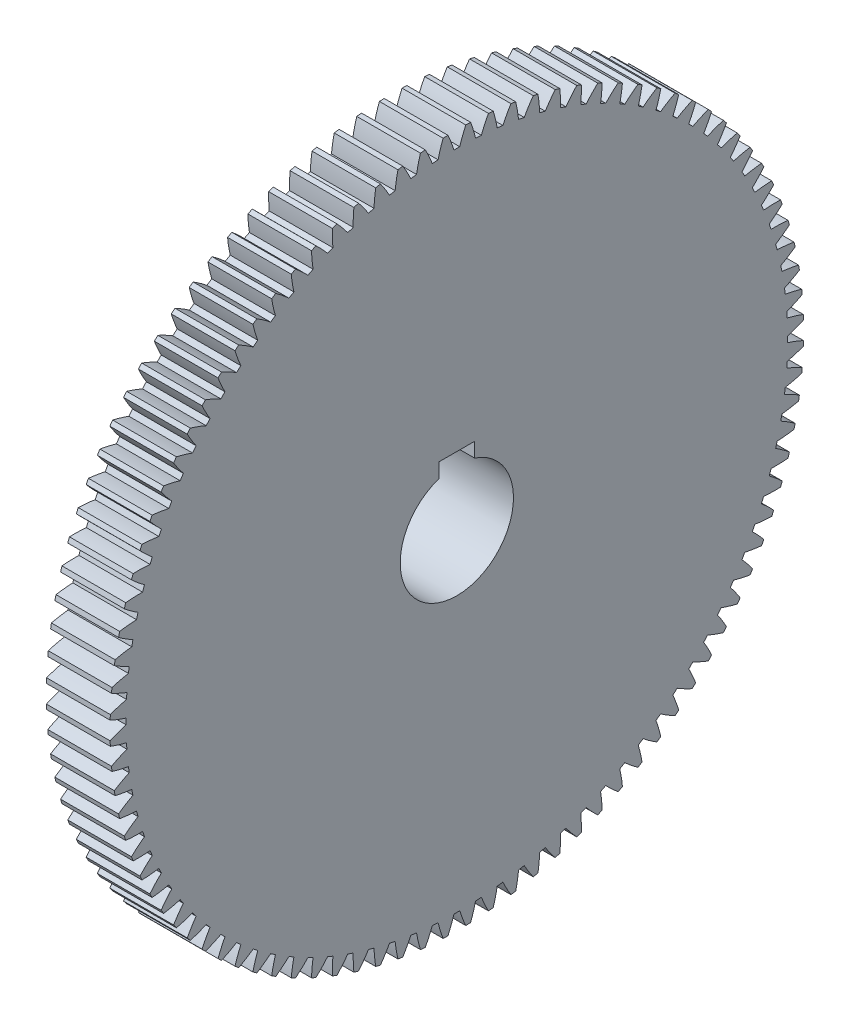
from build123d import *

# Parameters (mm, degrees)
BASPROSKE_W      = 18
BASPROSKE_H      = 98
TOOTHCUT_DEPTH   = 140.75693185
TEETHCUTS_COUNT  = 96
HUBNEAONESKE_R   = 30
HUBNEARONE_DEPTH = 13.5
BORSKE_R         = 16
BORE_DEPTH       = 30.0000508
KEYSKE_W         = 10
KEYSKE_H         = 19.3
KEYWAY_DEPTH     = 30.0000508


with BuildPart() as part:
    # BasProSke → Base-Revolve (revolve)
    with BuildSketch(Plane(origin=(0, 0, 0), x_dir=(1, 0, 0), z_dir=(0, 1, 0))):
        with Locations((9, 49)):
            Rectangle(BASPROSKE_W, BASPROSKE_H)
    revolve(axis=Axis((-10, 0, 0), (1, 0, 0)))

    # TooCutSke → ToothCut (cut, through all)
    with BuildSketch(Plane(origin=(0, 0, 0), x_dir=(0, 0, -1), z_dir=(1, 0, 0))):
        with BuildLine():
            ThreePointArc((0.816302804, 93.495436524), (0, 93.499), (-0.816302804, 93.495436524))
            ThreePointArc((-0.816302804, 93.495436524), (-1.605364709, 95.770990559), (-2.535528881, 97.992602468))
            ThreePointArc((-2.535528881, 97.992602468), (0, 98.0254), (2.535528881, 97.992602468))
            ThreePointArc((2.535528881, 97.992602468), (1.605364709, 95.770990559), (0.816302804, 93.495436524))
        make_face()
    toothcut = extrude(amount=TOOTHCUT_DEPTH, mode=Mode.SUBTRACT)

    # TeethCuts: ToothCut ×96 about axis
    teethcuts_axis = Axis((-10, 0, 0), (1, 0, 0))
    for i in range(1, TEETHCUTS_COUNT):
        add(toothcut.rotate(teethcuts_axis, i * 360 / TEETHCUTS_COUNT), mode=Mode.SUBTRACT)

    # HubNeaOneSke → HubNearOne (add)
    with BuildSketch(Plane.ZY):
        Circle(HUBNEAONESKE_R)
    extrude(amount=HUBNEARONE_DEPTH)

    # BorSke → Bore (cut, symmetric)
    with BuildSketch(Plane(origin=(0, 0, 0), x_dir=(0, 0, -1), z_dir=(1, 0, 0))):
        Circle(BORSKE_R)
    extrude(amount=BORE_DEPTH, both=True, mode=Mode.SUBTRACT)

    # KeySke → Keyway (cut, symmetric)
    with BuildSketch(Plane(origin=(0, 0, 0), x_dir=(0, 0, -1), z_dir=(1, 0, 0))):
        with Locations((0, 9.65)):
            Rectangle(KEYSKE_W, KEYSKE_H)
    extrude(amount=KEYWAY_DEPTH, both=True, mode=Mode.SUBTRACT)


solid = part.part
